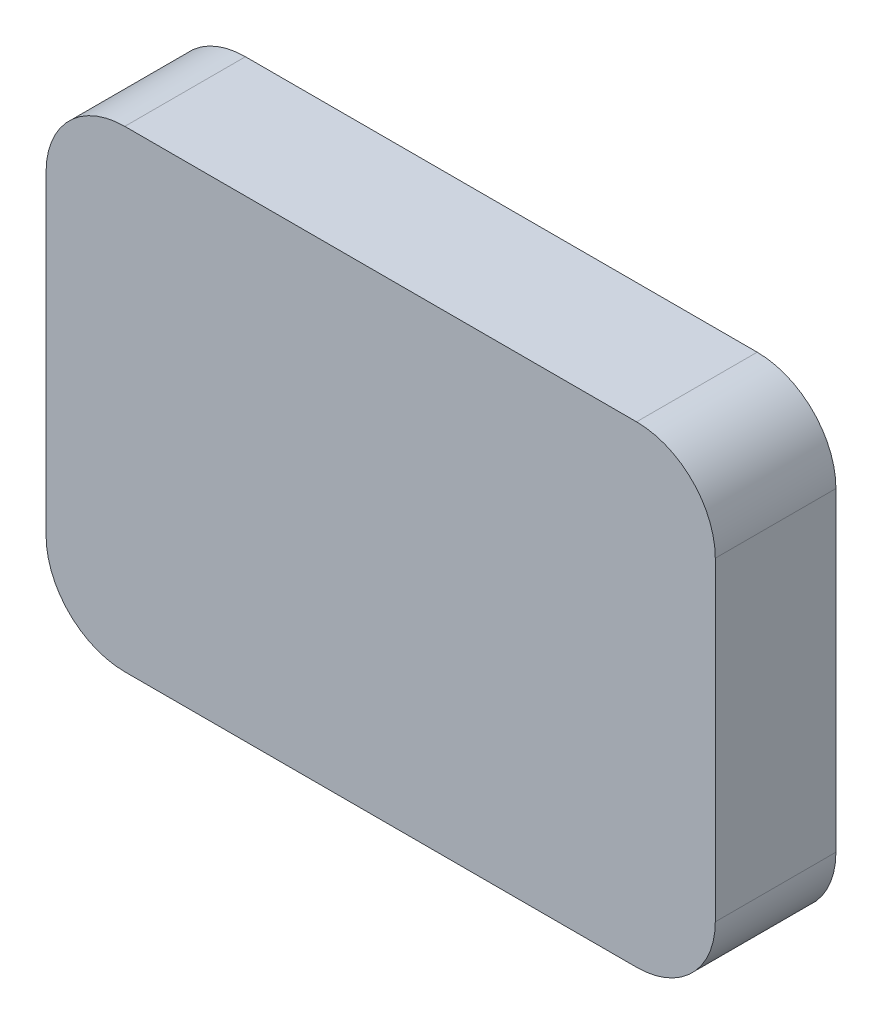
from build123d import *

# Parameters (mm, degrees)
BOSS_EXTRU_1_DEPTH = 1.2
CONG_1_R           = 2


with BuildPart() as part:
    # Balayage1: sweep along a path in Esquisse1
    with BuildLine(Plane.XY) as balayage1_path:
        Line((-32.5, 30), (32.5, 30))
        ThreePointArc((32.5, 30), (39.571067812, 27.071067812), (42.5, 20))
        Line((42.5, 20), (42.5, -20))
        ThreePointArc((42.5, -20), (39.571067812, -27.071067812), (32.5, -30))
        Line((32.5, -30), (-32.5, -30))
        ThreePointArc((-32.5, -30), (-39.571067812, -27.071067812), (-42.5, -20))
        Line((-42.5, -20), (-42.5, 20))
        ThreePointArc((-42.5, 20), (-39.571067812, 27.071067812), (-32.5, 30))
    # profil → Balayage1 (sweep)
    with BuildSketch(Plane(origin=(0, 0, 0), x_dir=(0, 0, -1), z_dir=(1, 0, 0))):
        with BuildLine():
            Line((0, -28.4), (4.139133187, -28.4))
            Line((4.139133187, -28.4), (14.1228, -23.8))
            Line((14.1228, -23.8), (14.1228, -25.4))
            ThreePointArc((14.1228, -25.4), (15.6228, -26.9), (14.1228, -28.4))
            Line((14.1228, -28.4), (14.1228, -30))
            Line((14.1228, -30), (0, -30))
            Line((0, -30), (0, -28.4))
        make_face()
    sweep(path=balayage1_path.line)

    # Esquisse1<3> → Boss.-Extru.1 (add)
    with BuildSketch(Plane.XY):
        with BuildLine():
            Line((-32.5, 30), (32.5, 30))
            ThreePointArc((32.5, 30), (39.571067812, 27.071067812), (42.5, 20))
            Line((42.5, 20), (42.5, -20))
            ThreePointArc((42.5, -20), (39.571067812, -27.071067812), (32.5, -30))
            Line((32.5, -30), (-32.5, -30))
            ThreePointArc((-32.5, -30), (-39.571067812, -27.071067812), (-42.5, -20))
            Line((-42.5, -20), (-42.5, 20))
            ThreePointArc((-42.5, 20), (-39.571067812, 27.071067812), (-32.5, 30))
        make_face()
    extrude(amount=BOSS_EXTRU_1_DEPTH)

    # Congé1
    cong_1_edges = [part.edges().sort_by_distance(p)[0] for p in [
        (-38.439696962, 25.939696962, 0),
        (-40.9, 0, 0),
        (-38.439696962, -25.939696962, 0),
        (0, -28.4, 0),
        (0, -28.4, 0),
        (38.439696962, -25.939696962, 0),
        (40.9, 0, 0),
        (38.439696962, 25.939696962, 0),
        (0, 28.4, 0),
    ]]
    fillet(cong_1_edges, radius=CONG_1_R)


solid = part.part
